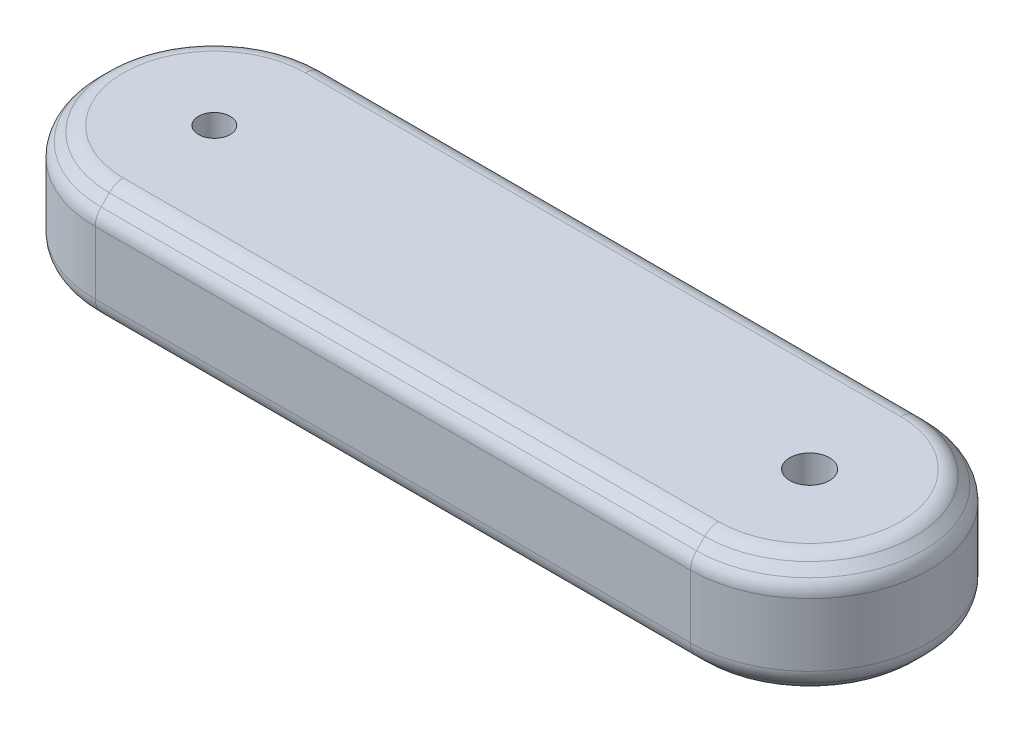
from build123d import *

# Parameters (mm, degrees)
BOSS_EXTRUDE1_DEPTH = 30
SKETCH2_R           = 5
CUT_EXTRUDE1_DEPTH  = 114.247516529
CHAMFER1_SIZE       = 5
FILLET1_R           = 5


# Read off the part's stored shape, not the designer's step: Ø8.0mm Dowel Hole1
with BuildPart() as part:
    # Sketch1 → Boss-Extrude1 (new body)
    with BuildSketch(Plane(origin=(0, 0, 0), x_dir=(1, 0, 0), z_dir=(0, 1, 0))):
        with BuildLine():
            Line((-75, 30), (75, 30))
            ThreePointArc((75, 30), (105, 0), (75, -30))
            Line((75, -30), (-75, -30))
            ThreePointArc((-75, -30), (-105, 0), (-75, 30))
        make_face()
    extrude(amount=BOSS_EXTRUDE1_DEPTH)

    # Sketch2 → Cut-Extrude1 (cut, through all)
    with BuildSketch(Plane(origin=(0, 30, 0), x_dir=(1, 0, 0), z_dir=(0, 1, 0))):
        with Locations(Location((75, 0, 0), (0, 0, 270))):
            Circle(SKETCH2_R)
    extrude(amount=-CUT_EXTRUDE1_DEPTH, mode=Mode.SUBTRACT)

    # Chamfer1
    chamfer1_edges = [part.edges().sort_by_distance(p)[0] for p in [
        (105, 30, 0),
        (0, 30, -30),
        (-105, 30, 0),
        (0, 0, -30),
        (105, 0, 0),
        (0, 0, 30),
        (-105, 0, 0),
        (0, 30, 30),
    ]]
    chamfer(chamfer1_edges, length=CHAMFER1_SIZE)

    # Fillet1
    fillet1_edges = [part.edges().sort_by_distance(p)[0] for p in [
        (0, 25, 30),
        (0, 5, 30),
        (0, 0, -25),
        (-100, 0, 0),
        (100, 0, 0),
        (0, 0, 25),
        (105, 25, 0),
        (105, 5, 0),
        (-105, 25, 0),
        (-105, 5, 0),
        (0, 25, -30),
        (0, 5, -30),
        (0, 30, -25),
        (-100, 30, 0),
        (100, 30, 0),
        (0, 30, 25),
    ]]
    fillet(fillet1_edges, radius=FILLET1_R)

    # Ø8.0mm Dowel Hole1 outline → Ø8.0mm Dowel Hole1 (revolve, cut)
    with BuildSketch(Plane(origin=(-75, 0, 0), x_dir=(1, 0, 0), z_dir=(0, 0, 1))):
        Polygon((0, 30), (0, 17.596557524), (4, 20), (4, 30), align=None)
        Polygon((4, 10), (0, 12.403442476), (0, 0), (4, 0), align=None)
    revolve(axis=Axis((-75, 0, 0), (0, 1, 0)), mode=Mode.SUBTRACT)


solid = part.part
